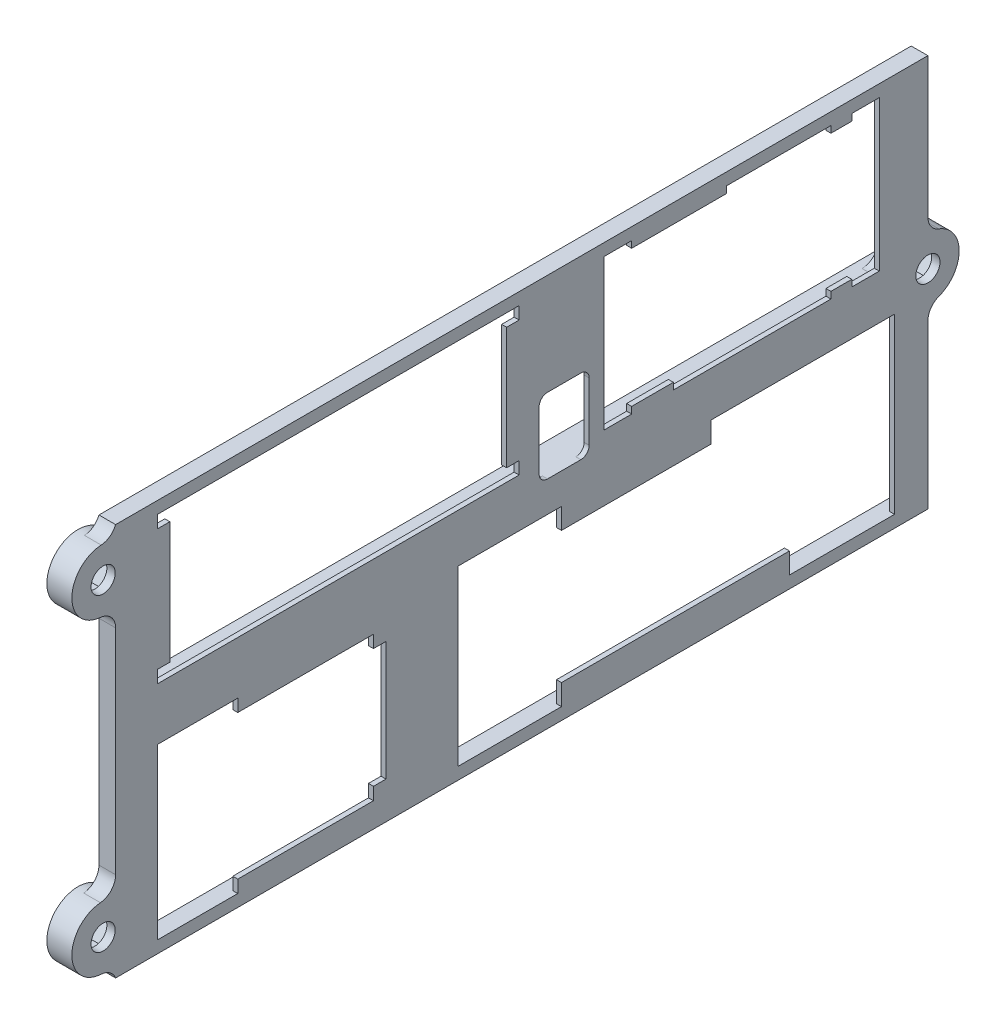
from build123d import *

# Parameters (mm, degrees)
BOSS_EXTRUDE1_DEPTH             = 0.6
SKETCH3_W                       = 40.4
SKETCH3_H                       = 14.6
SKETCH3_W_2                     = 31.4
SKETCH3_H_2                     = 16.42
SKETCH3_W_3                     = 40.3
SKETCH3_H_3                     = 15.8
SKETCH3_W_4                     = 24.43
SKETCH3_H_4                     = 17.3
CUT_EXTRUDE1_DEPTH              = 145.562685365
SKETCH4_W                       = 12.4
SKETCH4_H                       = 20.8
SKETCH4_W_2                     = 12.5
SKETCH4_H_2                     = 0.8
SKETCH4_W_3                     = 18.9
SKETCH4_W_4                     = 43.4
SKETCH4_H_3                     = 1.5
SKETCH4_W_5                     = 1.5
SKETCH4_H_4                     = 14.3
CUT_EXTRUDE2_DEPTH              = 145.562685365
SKETCH5_W                       = 97.43
SKETCH5_H                       = 47.1
SKETCH5_W_2                     = 94.53
SKETCH5_H_2                     = 44.2
BOSS_EXTRUDE2_DEPTH             = 2
BOSS_EXTRUDE3_REACH             = 146.575
SKETCH6_W                       = 94.53
SKETCH6_H                       = 2
BOSS_EXTRUDE3_DIRECTION_2_DEPTH = 2
SKETCH7_R                       = 3.75
BOSS_EXTRUDE4_DEPTH             = 3
CUT_EXTRUDE3_DEPTH              = 150.558759356
CUT_EXTRUDE3_DEPTH_BACK         = 2
SKETCH9_R                       = 1.45
CUT_EXTRUDE4_DEPTH              = 150.558759356
CHAMFER1_SIZE                   = 1
FILLET1_R                       = 2
CUT_EXTRUDE5_DEPTH              = 150.542042583
CUT_EXTRUDE5_DEPTH_BACK         = 150.542042583
SKETCH10_W                      = 6
SKETCH10_H                      = 9
FILLET2_R                       = 1


# Some blends are built 0.0001 mm under size
with BuildPart() as part:
    # Sketch1 → Boss-Extrude1 (new body)
    with BuildSketch(Plane(origin=(0, 0, 0), x_dir=(0, 0, -1), z_dir=(1, 0, 0))):
        Polygon((-39.07, 0.5), (-136.5, 0.5), (-136.5, 47.6), (-39.07, 47.6), (-39.07, 28.13), align=None)
    extrude(amount=BOSS_EXTRUDE1_DEPTH)

    # Sketch3 → Cut-Extrude1 (cut, through all)
    with BuildSketch(Plane(origin=(0.6, 0, 0), x_dir=(0, 0, -1), z_dir=(1, 0, 0))):
        with Locations((-109.8, 37.35)):
            Rectangle(SKETCH3_W, SKETCH3_H)
        with Locations((-61.4, 37.14)):
            Rectangle(SKETCH3_W_2, SKETCH3_H_2)
        with Locations((-67.72, 12.35)):
            Rectangle(SKETCH3_W_3, SKETCH3_H_3)
        with Locations((-117.785, 12.1)):
            Rectangle(SKETCH3_W_4, SKETCH3_H_4)
    extrude(amount=-CUT_EXTRUDE1_DEPTH, mode=Mode.SUBTRACT)

    # Sketch4 → Cut-Extrude2 (cut, through all)
    with BuildSketch(Plane.ZY):
        with Locations((89.22, 12.35)):
            Rectangle(SKETCH4_W, SKETCH4_H)
        Polygon((65.07, 22.75), (65.07, 20.25), (55.67, 20.25), (55.67, 1.95), (43.07, 1.95), (43.07, 22.75), align=None)
        Polygon((44.9, 28.13), (44.9, 46.15), (48.2, 46.15), (48.2, 45.35), (45.7, 45.35), (45.7, 28.93), (48.2, 28.93), (48.2, 28.13), align=None)
        Polygon((77.9, 28.13), (74.6, 28.13), (74.6, 28.93), (77.1, 28.93), (77.1, 45.35), (74.6, 45.35), (74.6, 46.15), (77.9, 46.15), align=None)
        with Locations((56.95, 45.75)):
            Rectangle(SKETCH4_W_2, SKETCH4_H_2)
        with Locations((60.15, 28.53)):
            Rectangle(SKETCH4_W_3, SKETCH4_H_2)
        with Locations((109.8, 45.4)):
            Rectangle(SKETCH4_W_4, SKETCH4_H_3)
        with Locations((109.8, 29.3)):
            Rectangle(SKETCH4_W_4, SKETCH4_H_3)
        Polygon((131.5, 1.95), (131.5, 22.25), (121.85, 22.25), (121.85, 20.75), (130, 20.75), (130, 3.45), (121.85, 3.45), (121.85, 1.95), align=None)
        with Locations((104.82, 12.1)):
            Rectangle(SKETCH4_W_5, SKETCH4_H_4)
    extrude(amount=-CUT_EXTRUDE2_DEPTH, mode=Mode.SUBTRACT)

    # Sketch5 → Boss-Extrude2 (add)
    with BuildSketch(Plane(origin=(0.6, 0, 0), x_dir=(0, 0, -1), z_dir=(1, 0, 0))):
        with Locations((-87.785, 24.05)):
            Rectangle(SKETCH5_W, SKETCH5_H)
        with Locations((-87.785, 24.05)):
            Rectangle(SKETCH5_W_2, SKETCH5_H_2, mode=Mode.SUBTRACT)
    extrude(amount=-BOSS_EXTRUDE2_DEPTH)

    # Sketch6 → Boss-Extrude3 (add, up to next)
    with BuildSketch(Plane.ZY.offset(1.4), mode=Mode.PRIVATE) as boss_extrude3_sk1:
        with Locations((87.785, 25.44)):
            Rectangle(SKETCH6_W, SKETCH6_H)
    boss_extrude3_tool1 = extrude(boss_extrude3_sk1.sketch, amount=-BOSS_EXTRUDE3_REACH, mode=Mode.PRIVATE) - part.part
    add(boss_extrude3_tool1.solids().sort_by_distance((-1.4, 25.44, 87.785))[0])

    # Sketch6 → Boss-Extrude3 direction 2 (add)
    with BuildSketch(Plane.ZY.offset(1.4)):
        with Locations((87.785, 25.44)):
            Rectangle(SKETCH6_W, SKETCH6_H)
    extrude(amount=BOSS_EXTRUDE3_DIRECTION_2_DEPTH)

    # Sketch7 → Boss-Extrude4 (add)
    with BuildSketch(Plane.ZY.offset(-0.6)):
        with Locations((39.07, 25.44)):
            Circle(SKETCH7_R)
        with Locations(Location((138, 42.6, 0), (0, 0, 141.875088378))):
            Circle(SKETCH7_R)
        with Locations(Location((138, 5.5, 0), (0, 0, 141.875088378))):
            Circle(SKETCH7_R)
    extrude(amount=BOSS_EXTRUDE4_DEPTH)

    # Sketch8 → Cut-Extrude3 (cut, two sides: drawn at the far end of the back side and taken through both)
    with BuildSketch(Plane.ZY.offset(2.4).offset(-CUT_EXTRUDE3_DEPTH_BACK)):
        Polygon((36.471923789, 25.44), (37.770961894, 23.19), (40.369038106, 23.19), (41.668076211, 25.44), (40.369038106, 27.69), (37.770961894, 27.69), align=None)
        Polygon((139.299038106, 44.85), (136.700961894, 44.85), (135.401923789, 42.6), (136.700961894, 40.35), (139.299038106, 40.35), (140.598076211, 42.6), align=None)
        Polygon((139.299038106, 7.75), (136.700961894, 7.75), (135.401923789, 5.5), (136.700961894, 3.25), (139.299038106, 3.25), (140.598076211, 5.5), align=None)
    extrude(amount=CUT_EXTRUDE3_DEPTH + CUT_EXTRUDE3_DEPTH_BACK, mode=Mode.SUBTRACT)

    # Sketch9 → Cut-Extrude4 (cut, through all)
    with BuildSketch(Plane.ZY.offset(0.4)):
        with Locations((138, 5.5)):
            Circle(SKETCH9_R)
        with Locations((138, 42.6)):
            Circle(SKETCH9_R)
        with Locations((39.07, 25.44)):
            Circle(SKETCH9_R)
    extrude(amount=-CUT_EXTRUDE4_DEPTH, mode=Mode.SUBTRACT)

    # Chamfer1
    chamfer1_edges = [part.edges().sort_by_distance(p)[0] for p in [
        (-1.4, 25.44, 135.05),
    ]]
    chamfer(chamfer1_edges, length=CHAMFER1_SIZE)
    chamfer1_2_edges = [part.edges().sort_by_distance(p)[0] for p in [
        (-2.9, 24.44, 135.05),
        (-2.9, 26.44, 135.05),
        (-3.4, 25.44, 135.05),
    ]]
    chamfer(chamfer1_2_edges, length=CHAMFER1_SIZE - 0.0001)  # a hair under: the kernel refuses the full size

    # Fillet1
    # the kernel refuses this fillet: 2 mm, written as the material it adds along each edge
    with BuildSketch(Plane(origin=(-2.4, 26.44, 42.684208074), x_dir=(0, 0, 1), z_dir=(1, 0, 0))) as fillet1_piece_1:
        with BuildLine():
            CenterArc((1.291146144, -2), FILLET1_R, 90, 58.551018611)
            Line((-0.415064019, -0.956521739), (-0.449188222, -0.935652174))
            ThreePointArc((-0.449188222, -0.935652174), (-0.210818686, -0.47683468), (-0.038551553, 0.010666667))
            Line((-0.038551553, 0.010666667), (0, 0.04))
            Line((0, 0.04), (1.291146144, 0.04))
            Line((1.291146144, 0.04), (1.291146144, 0))
        make_face()
    extrude(amount=2.4)
    with BuildSketch(Plane(origin=(-1.4, 21.69, 39.07), x_dir=(0, -1, 0), z_dir=(1, 0, 0))) as fillet1_piece_2:
        with BuildLine():
            CenterArc((1.640964663, 2), FILLET1_R, 200.354406398, 69.645593602)
            Line((-0.234153481, 1.304347826), (-0.271655843, 1.290434783))
            ThreePointArc((-0.271655843, 1.290434783), (-0.098373183, 0.655531532), (-0.04, 0))
            Line((-0.04, 0), (0, -0.04))
            Line((0, -0.04), (1.640964663, -0.04))
            Line((1.640964663, -0.04), (1.640964663, 0))
        make_face()
    extrude(amount=2)
    with BuildSketch(Plane(origin=(-1.4, 21.981676707, 40.52), x_dir=(0, -1, 0), z_dir=(1, 0, 0))) as fillet1_piece_3:
        with BuildLine():
            CenterArc((1.141676707, -2), FILLET1_R, 90, 53.130102354)
            Line((-0.458323293, -0.8), (-0.490323293, -0.776))
            ThreePointArc((-0.490323293, -0.776), (-0.23918937, -0.394255076), (-0.036888782, 0.015466667))
            Line((-0.036888782, 0.015466667), (0, 0.04))
            Line((0, 0.04), (1.141676707, 0.04))
            Line((1.141676707, 0.04), (1.141676707, 0))
        make_face()
    extrude(amount=1.4)
    with BuildSketch(Plane(origin=(-2.4, 24.44, 42.684208074), x_dir=(0, 0, 1), z_dir=(1, 0, 0))) as fillet1_piece_4:
        with BuildLine():
            CenterArc((1.291146144, 2), FILLET1_R, 211.448981389, 58.551018611)
            Line((-0.415064019, 0.956521739), (-0.449188222, 0.935652174))
            ThreePointArc((-0.449188222, 0.935652174), (-0.210818686, 0.47683468), (-0.038551553, -0.010666667))
            Line((-0.038551553, -0.010666667), (0, -0.04))
            Line((0, -0.04), (1.291146144, -0.04))
            Line((1.291146144, -0.04), (1.291146144, 0))
        make_face()
    extrude(amount=2.4)
    with BuildSketch(Plane(origin=(-1.4, 28.898323293, 40.52), x_dir=(0, 1, 0), z_dir=(1, 0, 0))) as fillet1_piece_5:
        with BuildLine():
            CenterArc((1.141676707, 2), FILLET1_R, 216.869897646, 53.130102354)
            Line((-0.458323293, 0.8), (-0.490323293, 0.776))
            ThreePointArc((-0.490323293, 0.776), (-0.23918937, 0.394255076), (-0.036888782, -0.015466667))
            Line((-0.036888782, -0.015466667), (0, -0.04))
            Line((0, -0.04), (1.141676707, -0.04))
            Line((1.141676707, -0.04), (1.141676707, 0))
        make_face()
    extrude(amount=1.4)
    with BuildSketch(Plane(origin=(-1.4, 29.19, 39.07), x_dir=(0, 1, 0), z_dir=(1, 0, 0))) as fillet1_piece_6:
        with BuildLine():
            CenterArc((1.640964663, -2), FILLET1_R, 90, 69.645593602)
            Line((-0.234153481, -1.304347826), (-0.271655843, -1.290434783))
            ThreePointArc((-0.271655843, -1.290434783), (-0.098373183, -0.655531532), (-0.04, 0))
            Line((-0.04, 0), (0, 0.04))
            Line((0, 0.04), (1.640964663, 0.04))
            Line((1.640964663, 0.04), (1.640964663, 0))
        make_face()
    extrude(amount=2)
    with BuildSketch(Plane(origin=(-1.4, 39.163068229, 136.5), x_dir=(0, -0.1615145706174524, 0.9868703275903374), z_dir=(1, 0, 0))) as fillet1_piece_7:
        with BuildLine():
            CenterArc((2.343817028, 1.938174847), FILLET1_R, 170.705181749, 85.011458024)
            Line((0.370076373, 2.261203989), (0.33060156, 2.267664571))
            Line((0.33060156, 2.267664571), (-0.039474813, 0.006460583))
            Line((-0.039474813, 0.006460583), (0.009868703, -0.038763497))
            ThreePointArc((0.009868703, -0.038763497), (0.925190932, 0.075922161), (1.840513161, -0.038763497))
            Line((1.840513161, -0.038763497), (1.850381864, 0))
        make_face()
    extrude(amount=2)
    with BuildSketch(Plane(origin=(-1.4, 46.036931771, 136.5), x_dir=(0, 0.1736759126148829, 0.9848028621898839), z_dir=(1, 0, 0))) as fillet1_piece_8:
        with BuildLine():
            CenterArc((2.230073146, -1.944114194), FILLET1_R, 103.576564864, 64.746091666)
            Line((0.271467301, -1.539314066), (0.232295184, -1.531218063))
            ThreePointArc((0.232295184, -1.531218063), (0.096341536, -0.776604069), (-0.039392114, -0.006947037))
            Line((-0.039392114, -0.006947037), (0.009389782, 0.038882284))
            ThreePointArc((0.009389782, 0.038882284), (0.880292031, -0.064785886), (1.751194281, 0.038882284))
            Line((1.751194281, 0.038882284), (1.760584063, 0))
        make_face()
    extrude(amount=2)
    with BuildSketch(Plane(origin=(0, 44.915167381, 135.05), x_dir=(0, -0.8255542427014289, -0.5643227732049012), z_dir=(-1, 0, 0)), Plane(origin=(-1.4, 40.284832619, 135.05), x_dir=(0, 0.8255542427012595, -0.5643227732051488), z_dir=(1, 0, 0)), Plane(origin=(0, 7.815167381, 135.05), x_dir=(0, -0.825554242701426, -0.5643227732049054), z_dir=(-1, 0, 0))) as fillet1_piece_9:
        with BuildLine():
            CenterArc((0.624578317, -1.995672903), FILLET1_R, 93.769634942, 30.585641738)
            Line((-0.504067229, -0.344564417), (-0.52664014, -0.311542248))
            Line((-0.52664014, -0.311542248), (-0.022572911, 0.03302217))
            Line((-0.022572911, 0.03302217), (0.002629803, 0.039913458))
            ThreePointArc((0.002629803, 0.039913458), (0.246544073, 0.031886693), (0.490458342, 0.039913458))
            Line((0.490458342, 0.039913458), (0.493088145, 0))
        make_face()
    extrude(amount=1.4)
    with BuildSketch(Plane(origin=(-1.4, 2.063068229, 136.5), x_dir=(0, -0.17367591261488685, 0.9848028621898832), z_dir=(1, 0, 0))) as fillet1_piece_10:
        with BuildLine():
            CenterArc((2.230073146, 1.944114194), FILLET1_R, 191.67734347, 64.746091666)
            Line((0.271467301, 1.539314066), (0.232295184, 1.531218063))
            ThreePointArc((0.232295184, 1.531218063), (0.096341536, 0.776604069), (-0.039392114, 0.006947037))
            Line((-0.039392114, 0.006947037), (0.009389782, -0.038882284))
            ThreePointArc((0.009389782, -0.038882284), (0.880292031, 0.064785886), (1.751194281, -0.038882284))
            Line((1.751194281, -0.038882284), (1.760584063, 0))
        make_face()
    extrude(amount=2)
    with BuildSketch(Plane(origin=(-1.4, 8.936931771, 136.5), x_dir=(0, 0.16151457061745614, 0.9868703275903369), z_dir=(1, 0, 0))) as fillet1_piece_11:
        with BuildLine():
            CenterArc((2.343817028, -1.938174847), FILLET1_R, 104.283360227, 85.011458024)
            Line((0.370076373, -2.261203989), (0.33060156, -2.267664571))
            Line((0.33060156, -2.267664571), (-0.039474813, -0.006460583))
            Line((-0.039474813, -0.006460583), (0.009868703, 0.038763497))
            ThreePointArc((0.009868703, 0.038763497), (0.925190932, -0.075922161), (1.840513161, 0.038763497))
            Line((1.840513161, 0.038763497), (1.850381864, 0))
        make_face()
    extrude(amount=2)
    with BuildSketch(Plane(origin=(-1.4, 3.184832619, 135.05), x_dir=(0, -1, 0), z_dir=(1, 0, 0))) as fillet1_piece_12:
        with BuildLine():
            CenterArc((0.610580387, 2), FILLET1_R, 239.414358262, 30.585641738)
            Line((-0.40707101, 0.27826087), (-0.427424038, 0.243826087))
            ThreePointArc((-0.427424038, 0.243826087), (-0.221529892, 0.11280624), (-0.024695119, -0.031466667))
            Line((-0.024695119, -0.031466667), (0, -0.04))
            Line((0, -0.04), (0.610580387, -0.04))
            Line((0.610580387, -0.04), (0.610580387, 0))
        make_face()
    extrude(amount=1.4)

    # Sketch10 → Cut-Extrude5 (cut, two sides: drawn at the far end of the back side and taken through both)
    with BuildSketch(Plane.ZY.offset(1.4).offset(-CUT_EXTRUDE5_DEPTH_BACK)):
        with Locations((82.7, 30.94)):
            Rectangle(SKETCH10_W, SKETCH10_H)
    extrude(amount=CUT_EXTRUDE5_DEPTH + CUT_EXTRUDE5_DEPTH_BACK, mode=Mode.SUBTRACT)

    # Fillet2
    fillet2_edges = [part.edges().sort_by_distance(p)[0] for p in [
        (0.3, 26.44, 79.7),
        (0.3, 35.44, 79.7),
        (0.3, 35.44, 85.7),
        (0.3, 26.44, 85.7),
    ]]
    fillet(fillet2_edges, radius=FILLET2_R)


solid = part.part
